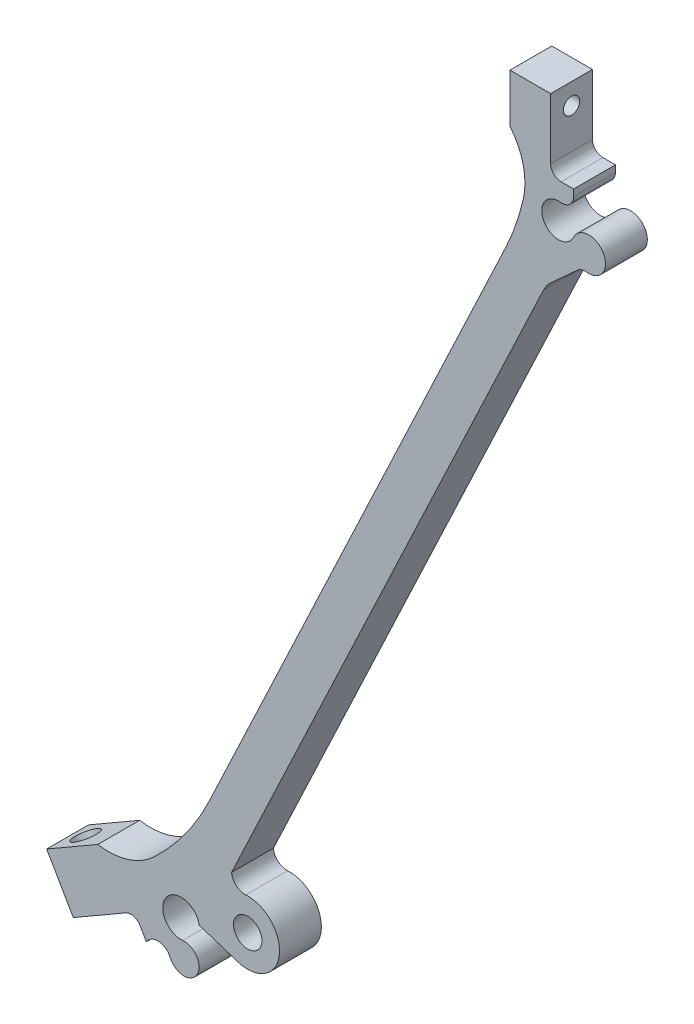
from build123d import *

# Parameters (mm, degrees)
SKETCH1_R                 = 2.159
BOSS_EXTRUDE1_DEPTH       = 6.35
SKETCH2_R                 = 1.8288
CUT_EXTRUDE1_DEPTH        = 192.647335654
SKETCH3_R                 = 0.635
CUT_EXTRUDE2_DEPTH        = 192.476049021
FILLET1_R                 = 1.5875
FILLET2_R                 = 38.1
M3X0_5_TAPPED_HOLE1_D     = 2.5
M3X0_5_TAPPED_HOLE1_DEPTH = 7.50062
M3X0_5_TAPPED_HOLE1_TIP   = 0.751075774
CORTAR_EXTRUIR1_DEPTH     = 10
CROQUIS8_W                = 8.969129367
CROQUIS8_H                = 6.35
CROQUIS8_R                = 1.8288
SALIENTE_EXTRUIR3_DEPTH   = 3
CROQUIS7_W                = 6.35
CROQUIS7_H                = 7.383174339
CROQUIS7_R                = 1.25
SALIENTE_EXTRUIR4_DEPTH   = 3
REDONDEO1_R               = 10


with BuildPart() as part:
    # Sketch1 → Boss-Extrude1 (new body)
    with BuildSketch(Plane.XY):
        with BuildLine():
            Line((15.834722261, 31.434493723), (25.183466494, 36.831993723))
            Line((25.183466494, 36.831993723), (26.929716494, 33.8074))
            Line((26.929716494, 33.8074), (27.78608986, 34.301827393))
            ThreePointArc((27.78608986, 34.301827393), (29.23868298, 34.44834582), (30.311273673, 33.457869357))
            ThreePointArc((30.311273673, 33.457869357), (34.825897025, 33.143744407), (32.428977808, 36.9824))
            ThreePointArc((32.428977808, 36.9824), (30.032058591, 40.821055593), (34.546681944, 40.506930643))
            ThreePointArc((34.546681944, 40.506930643), (34.984344673, 39.889437479), (35.639187691, 39.509928464))
            Line((35.639187691, 39.509928464), (40.774282272, 37.860721969))
            ThreePointArc((40.774282272, 37.860721969), (47.368100791, 42.064756802), (42.017768622, 47.767939879))
            ThreePointArc((42.017768622, 47.767939879), (40.437125748, 48.5456558), (40.301653082, 50.302050149))
            Line((40.301653082, 50.302050149), (87.227692295, 149.642175178))
            ThreePointArc((87.227692295, 149.642175178), (87.739785188, 150.497310852), (88.408996906, 151.235993347))
            Line((88.408996906, 151.235993347), (92.404798917, 154.858512458))
            ThreePointArc((92.404798917, 154.858512458), (93.060884875, 155.23586864), (93.814481006, 155.3061491))
            ThreePointArc((93.814481006, 155.3061491), (96.343832869, 159.058865136), (91.821, 158.9024))
            ThreePointArc((91.821, 158.9024), (87.298167131, 158.745934864), (89.827518994, 162.4986509))
            ThreePointArc((89.827518994, 162.4986509), (91.22159212, 162.932303457), (91.821, 164.263545213))
            Line((91.821, 164.263545213), (91.821, 165.2524))
            Line((91.821, 165.2524), (88.3285, 165.2524))
            Line((88.3285, 165.2524), (88.3285, 176.0474))
            Line((88.3285, 176.0474), (85.1535, 176.0474))
            Line((85.1535, 176.0474), (85.1535, 160.118189826))
            Line((85.1535, 160.118189826), (31.375529243, 46.272861553))
            Line((31.375529243, 46.272861553), (13.294722261, 35.833902774))
            Line((13.294722261, 35.833902774), (15.834722261, 31.434493723))
        make_face()
        with Locations((42.327648174, 42.6974)):
            Circle(SKETCH1_R, mode=Mode.SUBTRACT)
    extrude(amount=BOSS_EXTRUDE1_DEPTH)

    # Sketch2 → Cut-Extrude1 (cut, through all)
    with BuildSketch(Plane(origin=(-9.652854494, 16.719234422, 0), x_dir=(-0.8660254037844398, -0.49999999999999806, 0), z_dir=(0.499999999999998, -0.8660254037844397, 0))):
        with Locations(Location((-32.605518601, -3.175, 0), (0, 0, 180))):
            Circle(SKETCH2_R)
    extrude(amount=-CUT_EXTRUDE1_DEPTH, mode=Mode.SUBTRACT)

    # Sketch3 → Cut-Extrude2 (cut, through all)
    with BuildSketch(Plane(origin=(88.3285, 0, 0), x_dir=(0, 0, -1), z_dir=(1, 0, 0))):
        with Locations((-3.175, 172.8724)):
            Circle(SKETCH3_R)
    extrude(amount=-CUT_EXTRUDE2_DEPTH, mode=Mode.SUBTRACT)

    # Fillet1
    fillet1_edges = [part.edges().sort_by_distance(p)[0] for p in [
        (88.3285, 165.2524, 3.175),
        (25.183466494, 36.831993723, 3.175),
    ]]
    fillet(fillet1_edges, radius=FILLET1_R)

    # Fillet2
    fillet2_edges = [part.edges().sort_by_distance(p)[0] for p in [
        (31.375529243, 46.272861553, 3.175),
        (85.1535, 160.118189826, 3.175),
    ]]
    fillet(fillet2_edges, radius=FILLET2_R)

    # M3x0.5 Tapped Hole1
    with Locations(Plane.ZY.offset(-85.1535)):
        with Locations((3.175, 172.8724)):
            Hole(M3X0_5_TAPPED_HOLE1_D / 2, depth=M3X0_5_TAPPED_HOLE1_DEPTH)
            with Locations((0, 0, -(M3X0_5_TAPPED_HOLE1_DEPTH + M3X0_5_TAPPED_HOLE1_TIP / 2))):  # 118° drill point
                Cone(0, M3X0_5_TAPPED_HOLE1_D / 2, M3X0_5_TAPPED_HOLE1_TIP, mode=Mode.SUBTRACT)

    # Croquis1 → Cortar-Extruir1 (cut)
    with BuildSketch(Plane(origin=(0, 0, 0), x_dir=(-1, 0, 0), z_dir=(0, 0, -1))):
        with BuildLine():
            ThreePointArc((-42.017768622, 47.767939879), (-47.368100791, 42.064756802), (-40.774282272, 37.860721969))
            Line((-40.774282272, 37.860721969), (-35.639187691, 39.509928464))
            ThreePointArc((-35.639187691, 39.509928464), (-34.984344673, 39.889437479), (-34.546681944, 40.506930643))
            ThreePointArc((-34.546681944, 40.506930643), (-30.032058591, 40.821055593), (-32.428977808, 36.9824))
            ThreePointArc((-32.428977808, 36.9824), (-34.825897025, 33.143744407), (-30.311273673, 33.457869357))
            ThreePointArc((-30.311273673, 33.457869357), (-29.23868298, 34.44834582), (-27.78608986, 34.301827393))
            Line((-27.78608986, 34.301827393), (-26.94132658, 33.814103086))
            ThreePointArc((-26.94132658, 33.814103086), (-28.820278114, 34.784830402), (-30.541333264, 33.555708942))
            ThreePointArc((-30.541333264, 33.555708942), (-34.611603925, 33.272501802), (-32.450601953, 36.733336963))
            ThreePointArc((-32.450601953, 36.733336963), (-29.998259186, 41.214498053), (-34.957952736, 39.991293387))
            Line((-34.957952736, 39.991293387), (-40.850727445, 38.098747463))
            ThreePointArc((-40.850727445, 38.098747463), (-47.12004702, 42.095890817), (-42.0330186, 47.518405436))
            ThreePointArc((-42.0330186, 47.518405436), (-40.565017979, 48.024188561), (-39.885018398, 49.420054945))
            Line((-39.885018398, 49.420054945), (-40.301653082, 50.302050149))
            ThreePointArc((-40.301653082, 50.302050149), (-40.437125748, 48.5456558), (-42.017768622, 47.767939879))
        make_face()
    extrude(amount=-CORTAR_EXTRUIR1_DEPTH, mode=Mode.SUBTRACT)

    # Croquis8 → Saliente-Extruir3 (add)
    with BuildSketch(Plane(origin=(-12.192854494, 21.118643474, 0), x_dir=(0.8660254037844494, 0.4999999999999815, 0), z_dir=(-0.49999999999998146, 0.8660254037844493, 0))):
        with Locations((33.915083284, -3.175)):
            Rectangle(CROQUIS8_W, CROQUIS8_H)
        with Locations((32.605518601, -3.175)):
            Circle(CROQUIS8_R, mode=Mode.SUBTRACT)
    extrude(amount=SALIENTE_EXTRUIR3_DEPTH)

    # Croquis7 → Saliente-Extruir4 (add)
    with BuildSketch(Plane.ZY.offset(-85.1535)):
        with Locations((3.175, 172.355812831)):
            Rectangle(CROQUIS7_W, CROQUIS7_H)
        with Locations((3.175, 172.8724)):
            Circle(CROQUIS7_R, mode=Mode.SUBTRACT)
    extrude(amount=SALIENTE_EXTRUIR4_DEPTH)

    # Redondeo1
    # the kernel refuses this fillet: 10 mm, written as the material it adds along each edge
    with BuildSketch(Plane(origin=(21.062216142, 40.318467458, 0), x_dir=(-0.49999999999998396, 0.8660254037844479, 0), z_dir=(0, 0, 1))) as redondeo1_piece_1:
        with BuildLine():
            CenterArc((10.726495726, -6.348327637), REDONDEO1_R, 140.592418032, 52.464514334)
            Line((0.985035131, -8.607518967), (0.790205919, -8.652702794))
            ThreePointArc((0.790205919, -8.652702794), (0.048356716, -4.354588769), (-0.2, 0))
            Line((-0.2, 0), (0, 0.2))
            ThreePointArc((0, 0.2), (1.5, 0.2), (2.845470085, 0.126966553))
            Line((2.845470085, 0.126966553), (3, 0))
        make_face()
    extrude(amount=6.35)
    with BuildSketch(Plane(origin=(85.1535, 168.664225661, 0), x_dir=(-0.1136968347067967, -0.9935154904568199, 0), z_dir=(0, 0, 1))) as redondeo1_piece_2:
        with BuildLine():
            CenterArc((7.526730458, -9.935154905), REDONDEO1_R, 83.471533817, 52.464514334)
            Line((0.341090504, -2.980546471), (0.197377705, -2.841454303))
            ThreePointArc((0.197377705, -2.841454303), (-0.028157846, -1.513012603), (-0.198703098, -0.022739367))
            Line((-0.198703098, -0.022739367), (-0.022739367, 0.198703098))
            ThreePointArc((-0.022739367, 0.198703098), (4.331849402, 0.447059814), (8.686438172, 0.198703098))
            Line((8.686438172, 0.198703098), (8.663698805, 0))
        make_face()
    extrude(amount=6.35)


solid = part.part
